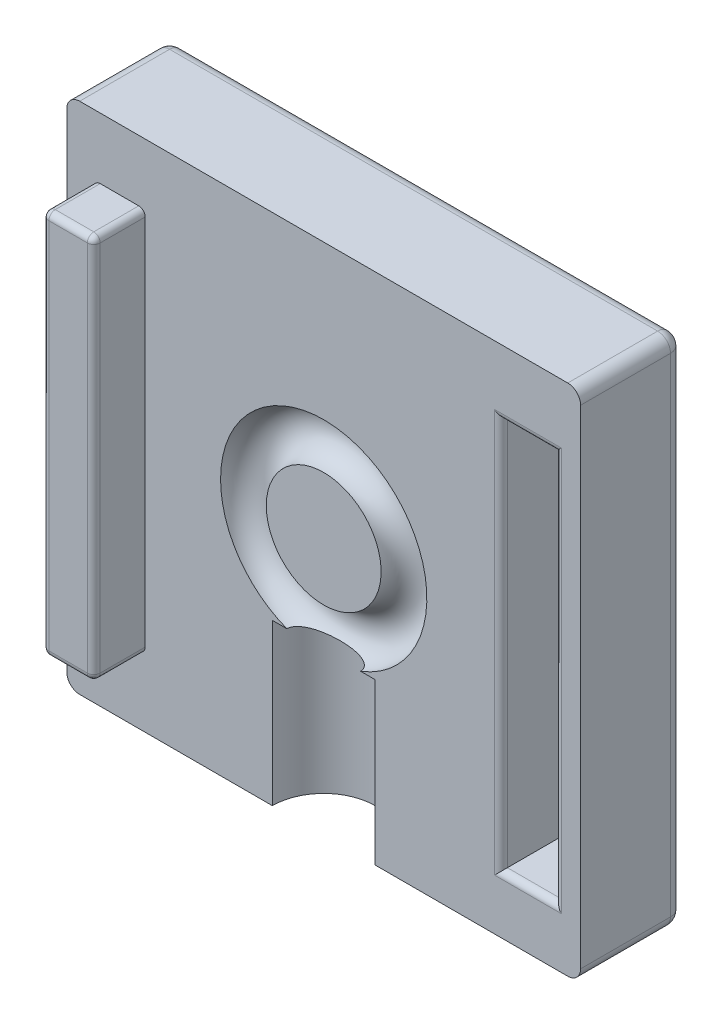
from build123d import *

# Parameters (mm, degrees)
SKETCH1_W               = 20
SKETCH1_H               = 20
BOSS_EXTRUDE1_DEPTH     = 4
SKETCH4_R               = 0.89
CUT_EXTRUDE1_DEPTH      = 0.25
CUT_EXTRUDE1_DEPTH_BACK = 8
SKETCH6_R               = 2
SKETCH7_W               = 2
SKETCH7_H               = 15
BOSS_EXTRUDE2_DEPTH     = 2
SKETCH8_W               = 2.1
SKETCH8_H               = 15.2
CUT_EXTRUDE2_DEPTH      = 2.5
FILLET1_R               = 0.25
FILLET2_R               = 0.25
FILLET3_R               = 0.25
FILLET5_R               = 0.5
FILLET6_R               = 0.5


with BuildPart() as part:
    # Sketch1 → Boss-Extrude1 (new body)
    with BuildSketch(Plane.XY):
        Rectangle(SKETCH1_W, SKETCH1_H)
    extrude(amount=BOSS_EXTRUDE1_DEPTH)

    # Sketch4 → Cut-Revolve1 (revolve, cut)
    with BuildSketch(Plane(origin=(0, 0, 0), x_dir=(1, 0, 0), z_dir=(0, 1, 0)), mode=Mode.PRIVATE) as cut_revolve1_sk:
        with Locations((3.125, -4)):
            Circle(SKETCH4_R)
    revolve(cut_revolve1_sk.sketch.rotate(Axis((0, 0, 0), (0, 0, 1)), 180), axis=Axis((0, 0, 0), (0, 0, 1)), mode=Mode.SUBTRACT)

    # Sketch6 → Cut-Extrude1 (cut, two sides: drawn at the far end of the back side and taken through both)
    with BuildSketch(Plane(origin=(0, -4, 0), x_dir=(1, 0, 0), z_dir=(0, 1, 0)).offset(-CUT_EXTRUDE1_DEPTH_BACK)):
        with Locations((0, -4)):
            Circle(SKETCH6_R)
    extrude(amount=CUT_EXTRUDE1_DEPTH + CUT_EXTRUDE1_DEPTH_BACK, mode=Mode.SUBTRACT)

    # Sketch7 → Boss-Extrude2 (add)
    with BuildSketch(Plane.XY.offset(4)):
        with Locations((-7.95, 0.121431972)):
            Rectangle(SKETCH7_W, SKETCH7_H)
    extrude(amount=BOSS_EXTRUDE2_DEPTH)

    # Sketch8 → Cut-Extrude2 (cut)
    with BuildSketch(Plane.XY.offset(4)):
        with Locations((7.95, -0.165781366)):
            Rectangle(SKETCH8_W, SKETCH8_H)
    extrude(amount=-CUT_EXTRUDE2_DEPTH, mode=Mode.SUBTRACT)

    # Fillet1
    fillet1_edges = [part.edges().sort_by_distance(p)[0] for p in [
        (-8.95, 0.121431972, 6),
        (-7.95, -7.378568028, 6),
        (-6.95, 0.121431972, 6),
        (-7.95, 7.621431972, 6),
    ]]
    fillet(fillet1_edges, radius=FILLET1_R)

    # Fillet2
    # the kernel refuses this fillet: 0.25 mm, written as the material it takes off along each edge
    with BuildSketch(Plane(origin=(-7.2, -7.128568028, 5.75), x_dir=(0, -1, 0), z_dir=(1, 0, 0))) as fillet2_piece_1_section:
        Polygon((0, 0), (FILLET2_R, 0), (FILLET2_R, -FILLET2_R), (0, -FILLET2_R), align=None)
    fillet2_piece_1 = extrude(amount=FILLET2_R, mode=Mode.PRIVATE)
    fillet2_piece_1 = fillet2_piece_1 - Plane(origin=(-7.2, -7.128568028, 5.75), x_dir=(0, 0.7071067811865475, -0.7071067811865475), z_dir=(1, 0, 0)) * Sphere(FILLET2_R, mode=Mode.PRIVATE)
    add(fillet2_piece_1, mode=Mode.SUBTRACT)
    with BuildSketch(Plane(origin=(-8.7, -7.128568028, 5.75), x_dir=(-1, 0, 0), z_dir=(0, -1, 0))) as fillet2_piece_2_section:
        Polygon((0, 0), (FILLET2_R, 0), (FILLET2_R, -FILLET2_R), (0, -FILLET2_R), align=None)
    fillet2_piece_2 = extrude(amount=FILLET2_R, mode=Mode.PRIVATE)
    fillet2_piece_2 = fillet2_piece_2 - Plane(origin=(-8.7, -7.128568028, 5.75), x_dir=(0.7071067811865475, 0, -0.7071067811865475), z_dir=(0, -1, 0)) * Sphere(FILLET2_R, mode=Mode.PRIVATE)
    add(fillet2_piece_2, mode=Mode.SUBTRACT)
    with BuildSketch(Plane(origin=(-7.2, 7.371431972, 5.75), x_dir=(0, 1, 0), z_dir=(1, 0, 0))) as fillet2_piece_3_section:
        Polygon((0, 0), (FILLET2_R, 0), (FILLET2_R, FILLET2_R), (0, FILLET2_R), align=None)
    fillet2_piece_3 = extrude(amount=FILLET2_R, mode=Mode.PRIVATE)
    fillet2_piece_3 = fillet2_piece_3 - Plane(origin=(-7.2, 7.371431972, 5.75), x_dir=(0, -0.7071067811865475, -0.7071067811865475), z_dir=(1, 0, 0)) * Sphere(FILLET2_R, mode=Mode.PRIVATE)
    add(fillet2_piece_3, mode=Mode.SUBTRACT)
    with BuildSketch(Plane(origin=(-8.7, 7.371431972, 5.75), x_dir=(-1, 0, 0), z_dir=(0, 1, 0))) as fillet2_piece_4_section:
        Polygon((0, 0), (FILLET2_R, 0), (FILLET2_R, FILLET2_R), (0, FILLET2_R), align=None)
    fillet2_piece_4 = extrude(amount=FILLET2_R, mode=Mode.PRIVATE)
    fillet2_piece_4 = fillet2_piece_4 - Plane(origin=(-8.7, 7.371431972, 5.75), x_dir=(0.7071067811865475, 0, -0.7071067811865475), z_dir=(0, 1, 0)) * Sphere(FILLET2_R, mode=Mode.PRIVATE)
    add(fillet2_piece_4, mode=Mode.SUBTRACT)
    with BuildSketch(Plane(origin=(-8.95, 7.621431972, 4), x_dir=(1, 0, 0), z_dir=(0, 0, 1)), Plane(origin=(-6.95, 7.621431972, 4), x_dir=(0, -1, 0), z_dir=(0, 0, 1))) as fillet2_piece_5:
        with BuildLine():
            CenterArc((FILLET2_R, -FILLET2_R), FILLET2_R, 90, 90)
            Line((0, -FILLET2_R), (0, 0))
            Line((0, 0), (FILLET2_R, 0))
        make_face()
    extrude(amount=1.75, mode=Mode.SUBTRACT)
    with BuildSketch(Plane(origin=(-6.95, -7.378568028, 4), x_dir=(0, 1, 0), z_dir=(0, 0, 1)), Plane(origin=(-8.95, -7.378568028, 4), x_dir=(1, 0, 0), z_dir=(0, 0, 1))) as fillet2_piece_6:
        with BuildLine():
            CenterArc((FILLET2_R, FILLET2_R), FILLET2_R, 180, 90)
            Line((0, FILLET2_R), (0, 0))
            Line((0, 0), (FILLET2_R, 0))
        make_face()
    extrude(amount=1.75, mode=Mode.SUBTRACT)

    # Fillet3
    fillet3_edges = [part.edges().sort_by_distance(p)[0] for p in [
        (6.9, -0.165781366, 4),
        (7.95, -7.765781366, 4),
        (9, -0.165781366, 4),
        (7.95, 7.434218634, 4),
    ]]
    fillet(fillet3_edges, radius=FILLET3_R)

    # Fillet5
    fillet5_edges = [part.edges().sort_by_distance(p)[0] for p in [
        (0, 10, 0),
        (10, 0, 0),
        (0, -10, 0),
        (-10, 0, 0),
    ]]
    fillet(fillet5_edges, radius=FILLET5_R)

    # Fillet6
    # the kernel refuses this fillet: 0.5 mm, written as the material it takes off along each edge
    with BuildSketch(Plane(origin=(-9.5, 9.5, 0.5), x_dir=(-1, 0, 0), z_dir=(0, 1, 0))) as fillet6_piece_1_section:
        Polygon((0, 0), (FILLET6_R, 0), (FILLET6_R, -FILLET6_R), (0, -FILLET6_R), align=None)
    fillet6_piece_1 = extrude(amount=FILLET6_R, mode=Mode.PRIVATE)
    fillet6_piece_1 = fillet6_piece_1 - Plane(origin=(-9.5, 9.5, 0.5), x_dir=(0.7071067811865475, 0, 0.7071067811865475), z_dir=(0, 1, 0)) * Sphere(FILLET6_R, mode=Mode.PRIVATE)
    add(fillet6_piece_1, mode=Mode.SUBTRACT)
    with BuildSketch(Plane(origin=(9.5, 9.5, 0.5), x_dir=(0, 1, 0), z_dir=(1, 0, 0))) as fillet6_piece_2_section:
        Polygon((0, 0), (FILLET6_R, 0), (FILLET6_R, -FILLET6_R), (0, -FILLET6_R), align=None)
    fillet6_piece_2 = extrude(amount=FILLET6_R, mode=Mode.PRIVATE)
    fillet6_piece_2 = fillet6_piece_2 - Plane(origin=(9.5, 9.5, 0.5), x_dir=(0, -0.7071067811865475, 0.7071067811865475), z_dir=(1, 0, 0)) * Sphere(FILLET6_R, mode=Mode.PRIVATE)
    add(fillet6_piece_2, mode=Mode.SUBTRACT)
    with BuildSketch(Plane(origin=(-9.5, -9.5, 0.5), x_dir=(-1, 0, 0), z_dir=(0, -1, 0))) as fillet6_piece_3_section:
        Polygon((0, 0), (FILLET6_R, 0), (FILLET6_R, FILLET6_R), (0, FILLET6_R), align=None)
    fillet6_piece_3 = extrude(amount=FILLET6_R, mode=Mode.PRIVATE)
    fillet6_piece_3 = fillet6_piece_3 - Plane(origin=(-9.5, -9.5, 0.5), x_dir=(0.7071067811865475, 0, 0.7071067811865475), z_dir=(0, -1, 0)) * Sphere(FILLET6_R, mode=Mode.PRIVATE)
    add(fillet6_piece_3, mode=Mode.SUBTRACT)
    with BuildSketch(Plane(origin=(9.5, -9.5, 0.5), x_dir=(0, -1, 0), z_dir=(1, 0, 0))) as fillet6_piece_4_section:
        Polygon((0, 0), (FILLET6_R, 0), (FILLET6_R, FILLET6_R), (0, FILLET6_R), align=None)
    fillet6_piece_4 = extrude(amount=FILLET6_R, mode=Mode.PRIVATE)
    fillet6_piece_4 = fillet6_piece_4 - Plane(origin=(9.5, -9.5, 0.5), x_dir=(0, 0.7071067811865475, 0.7071067811865475), z_dir=(1, 0, 0)) * Sphere(FILLET6_R, mode=Mode.PRIVATE)
    add(fillet6_piece_4, mode=Mode.SUBTRACT)
    with BuildSketch(Plane(origin=(-10, 10, 0.5), x_dir=(1, 0, 0), z_dir=(0, 0, 1)), Plane(origin=(10, 10, 0.5), x_dir=(0, -1, 0), z_dir=(0, 0, 1))) as fillet6_piece_5:
        with BuildLine():
            CenterArc((FILLET6_R, -FILLET6_R), FILLET6_R, 90, 90)
            Line((0, -FILLET6_R), (0, 0))
            Line((0, 0), (FILLET6_R, 0))
        make_face()
    extrude(amount=4.75, mode=Mode.SUBTRACT)
    with BuildSketch(Plane(origin=(10, -10, 0.5), x_dir=(0, 1, 0), z_dir=(0, 0, 1)), Plane(origin=(-10, -10, 0.5), x_dir=(1, 0, 0), z_dir=(0, 0, 1))) as fillet6_piece_6:
        with BuildLine():
            CenterArc((FILLET6_R, FILLET6_R), FILLET6_R, 180, 90)
            Line((0, FILLET6_R), (0, 0))
            Line((0, 0), (FILLET6_R, 0))
        make_face()
    extrude(amount=4.75, mode=Mode.SUBTRACT)


solid = part.part
